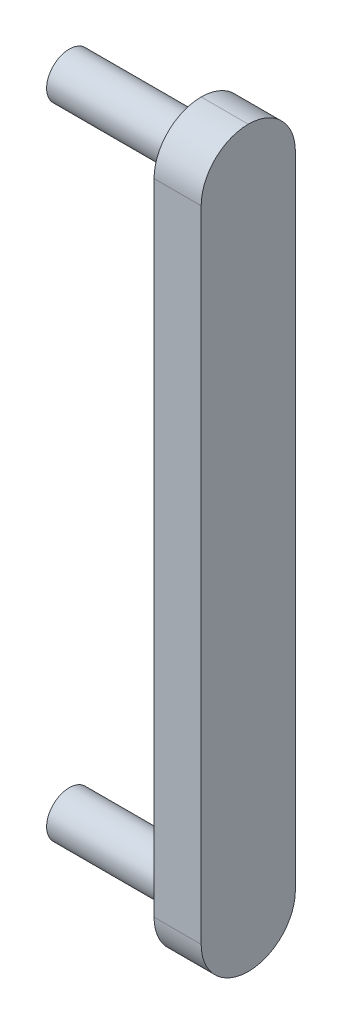
from build123d import *

# Parameters (mm, degrees)
SKETCH1_W           = 6.35
SKETCH1_H           = 49.4538
BOSS_EXTRUDE1_DEPTH = 3.175
SKETCH2_R           = 1.524
BOSS_EXTRUDE2_DEPTH = 8.89
FILLET1_R           = 3.175


with BuildPart() as part:
    # Sketch1 → Boss-Extrude1 (new body)
    with BuildSketch(Plane(origin=(0, 0, 0), x_dir=(0, 0, -1), z_dir=(1, 0, 0))):
        Rectangle(SKETCH1_W, SKETCH1_H)
    extrude(amount=BOSS_EXTRUDE1_DEPTH)

    # Sketch2 → Boss-Extrude2 (add)
    with BuildSketch(Plane.ZY):
        with Locations(Location((0, 21.5519, 0), (0, 0, 180))):
            Circle(SKETCH2_R)
        with Locations(Location((0, -21.5519, 0), (0, 0, 180))):
            Circle(SKETCH2_R)
    extrude(amount=BOSS_EXTRUDE2_DEPTH)

    # Fillet1
    fillet1_edges = [part.edges().sort_by_distance(p)[0] for p in [
        (1.5875, -24.7269, 3.175),
        (1.5875, -24.7269, -3.175),
        (1.5875, 24.7269, -3.175),
        (1.5875, 24.7269, 3.175),
    ]]
    fillet(fillet1_edges, radius=FILLET1_R - 0.0001)  # a hair under: the kernel refuses the full size


solid = part.part
